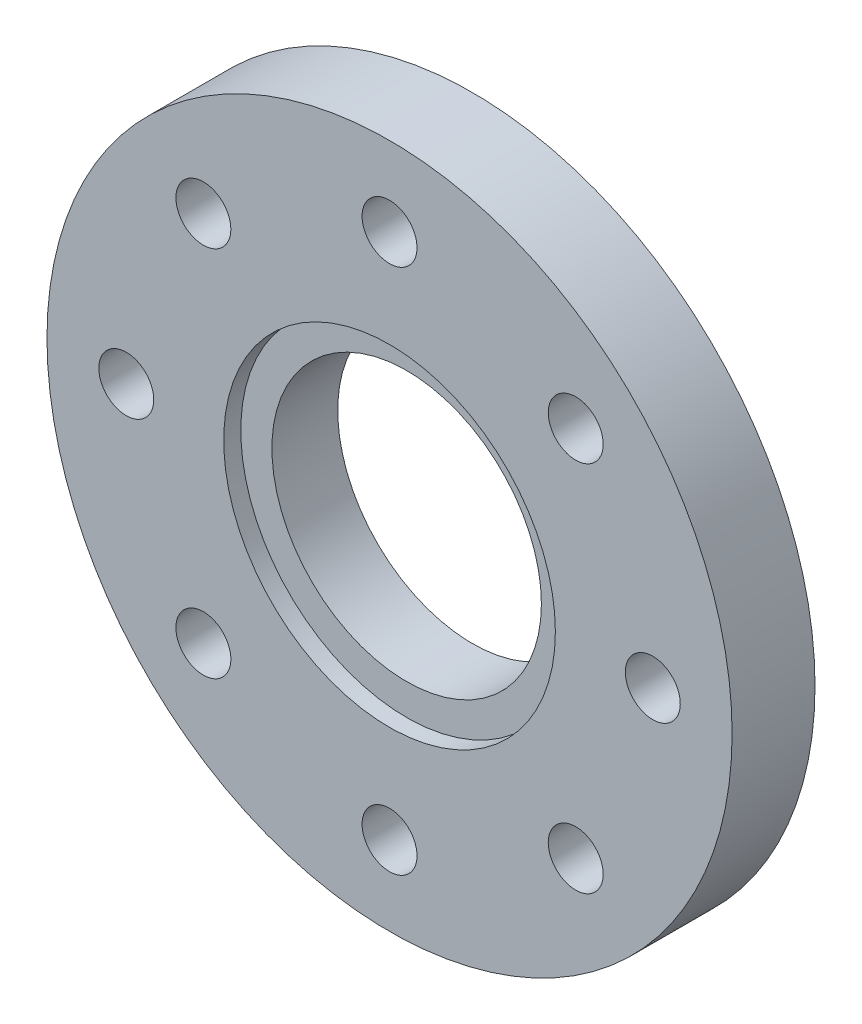
from build123d import *

# Parameters (mm, degrees)
SKETCH1_R           = 33.05
SKETCH1_R_2         = 13
BOSS_EXTRUDE1_DEPTH = 8
SKETCH1_10_R        = 16
SKETCH1_10_R_2      = 13
CUT_EXTRUDE1_DEPTH  = 1.65
SKETCH8_R           = 2.5
CUT_EXTRUDE2_DEPTH  = 4.1
SKETCH9_R           = 2.65
CUT_EXTRUDE3_DEPTH  = 8
CIRPATTERN1_COUNT   = 8


with BuildPart() as part:
    # Sketch1 → Boss-Extrude1 (new body)
    with BuildSketch(Plane.XY):
        Circle(SKETCH1_R)
        Circle(SKETCH1_R_2, mode=Mode.SUBTRACT)
    extrude(amount=-BOSS_EXTRUDE1_DEPTH)

    # Sketch1<10> → Cut-Extrude1 (cut)
    with BuildSketch(Plane.XY):
        Circle(SKETCH1_10_R)
        Circle(SKETCH1_10_R_2, mode=Mode.SUBTRACT)
    extrude(amount=-CUT_EXTRUDE1_DEPTH, mode=Mode.SUBTRACT)

    # Sketch8 → Cut-Extrude2 (cut)
    with BuildSketch(Plane(origin=(0, 0, -8), x_dir=(-1, 0, 0), z_dir=(0, 0, -1))):
        with Locations((-59.896098373, -103.852081394)):
            Circle(SKETCH8_R)
        with Locations((-77.856610615, -96.412593637)):
            Circle(SKETCH8_R)
        with Locations((-85.296098373, -78.452081395)):
            Circle(SKETCH8_R)
        with Locations((-77.856610615, -60.491569152)):
            Circle(SKETCH8_R)
        with Locations((-59.896098373, -53.052081395)):
            Circle(SKETCH8_R)
        with Locations((-41.935586131, -60.491569152)):
            Circle(SKETCH8_R)
        with Locations((-34.496098373, -78.452081395)):
            Circle(SKETCH8_R)
        with Locations((-41.935586131, -96.412593637)):
            Circle(SKETCH8_R)
        Polygon((2.482606158, 21.1), (4.965212315, 25.4), (2.482606158, 29.7), (-2.482606158, 29.7), (-4.965212315, 25.4), (-2.482606158, 21.1), align=None)
    cut_extrude2 = extrude(amount=-CUT_EXTRUDE2_DEPTH, mode=Mode.SUBTRACT)

    # Sketch9 → Cut-Extrude3 (cut)
    with BuildSketch(Plane(origin=(0, 0, -8), x_dir=(-1, 0, 0), z_dir=(0, 0, -1))):
        with Locations((0, 25.4)):
            Circle(SKETCH9_R)
    cut_extrude3 = extrude(amount=-CUT_EXTRUDE3_DEPTH, mode=Mode.SUBTRACT)

    # CirPattern1: Cut-Extrude2, Cut-Extrude3 ×8 about axis
    cirpattern1_axis = Axis((0, 0, -8), (0, 0, 1))
    add([cut_extrude2.rotate(cirpattern1_axis, i * 360 / CIRPATTERN1_COUNT) for i in range(1, CIRPATTERN1_COUNT)], mode=Mode.SUBTRACT)
    add([cut_extrude3.rotate(cirpattern1_axis, i * 360 / CIRPATTERN1_COUNT) for i in range(1, CIRPATTERN1_COUNT)], mode=Mode.SUBTRACT)


solid = part.part
